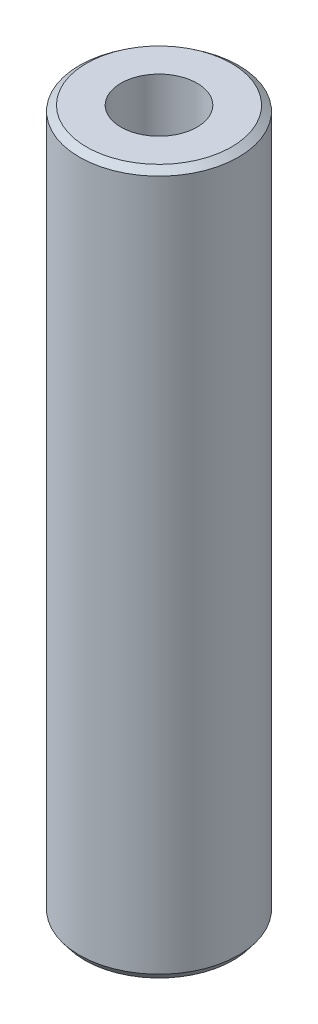
from build123d import *
from OCP.BRepFilletAPI import BRepFilletAPI_MakeChamfer

# Parameters (mm, degrees)
SKETCH1_R           = 57.5
BOSS_EXTRUDE1_DEPTH = 508.532402308
SKETCH2_R           = 27.537630998
CUT_EXTRUDE1_DEPTH  = 515.992916648
CHAMFER1_SIZE       = 3.814749188
CHAMFER1_SIZE2      = 5.072288001


with BuildPart() as part:
    # Sketch1 → Boss-Extrude1 (new body)
    with BuildSketch(Plane(origin=(0, 0, 0), x_dir=(1, 0, 0), z_dir=(0, 1, 0))):
        Circle(SKETCH1_R)
    extrude(amount=BOSS_EXTRUDE1_DEPTH)

    # Sketch2 → Cut-Extrude1 (cut, through all)
    with BuildSketch(Plane(origin=(0, 0, 0), x_dir=(1, 0, 0), z_dir=(0, 1, 0))):
        Circle(SKETCH2_R)
    extrude(amount=CUT_EXTRUDE1_DEPTH, mode=Mode.SUBTRACT)

    # Chamfer1: one chamfer whose edges measure the first distance from different faces: ONE call of the kernel's chamfer builder (chamfer() names one face for all edges)
    chamfer1_edges_1 = [part.edges().sort_by_distance(p)[0] for p in [
        (-57.5, 508.532402308, 0),
    ]]
    chamfer1_side_1 = [part.faces().sort_by_distance(p)[0] for p in [
        (-57.5, 254.266201154, 0),
    ]]
    chamfer1_edges_2 = [part.edges().sort_by_distance(p)[0] for p in [
        (-57.5, 0, 0),
    ]]
    chamfer1_side_2 = [part.faces().sort_by_distance(p)[0] for p in [
        (-55.873654403, 0, 0),
    ]]
    chamfer1 = BRepFilletAPI_MakeChamfer(part.part.solid().wrapped)
    for e in chamfer1_edges_1:
        chamfer1.Add(CHAMFER1_SIZE, CHAMFER1_SIZE2, e.wrapped, chamfer1_side_1[0].wrapped)  # the first distance lies on this face
    for e in chamfer1_edges_2:
        chamfer1.Add(CHAMFER1_SIZE, CHAMFER1_SIZE2, e.wrapped, chamfer1_side_2[0].wrapped)  # the first distance lies on this face
    add(Compound.cast(chamfer1.Shape()), mode=Mode.REPLACE)


solid = part.part
